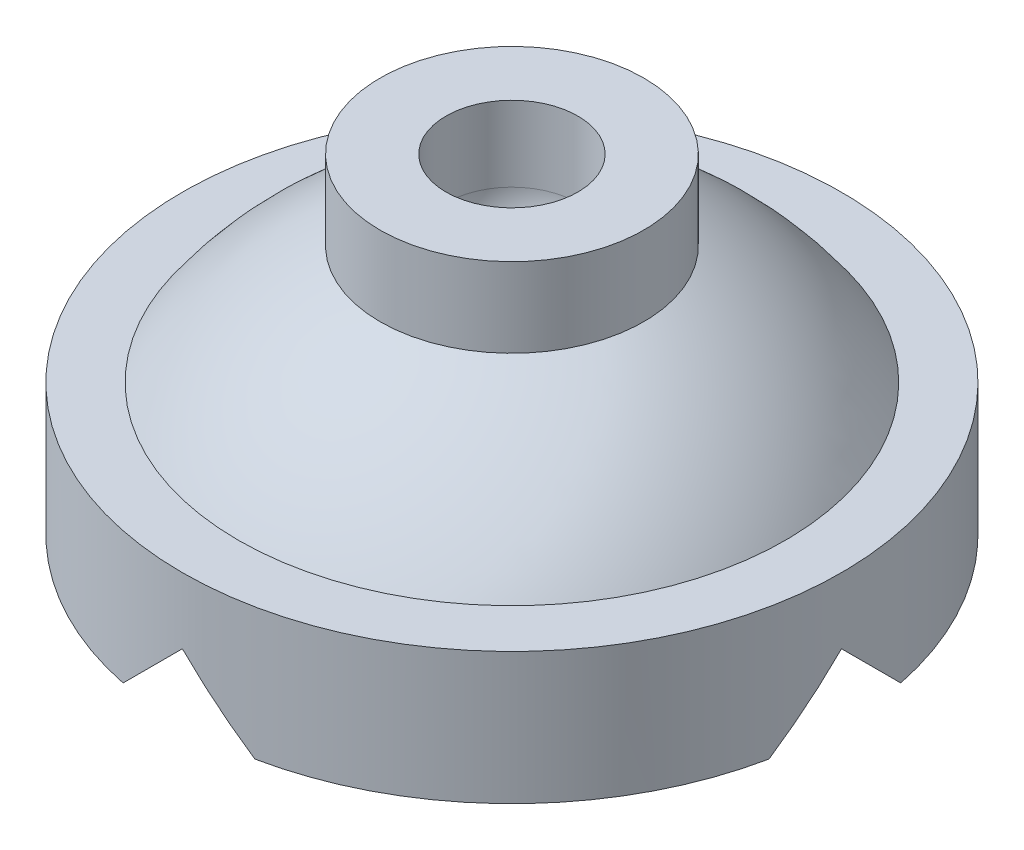
from build123d import *

# Parameters (mm, degrees)
CUT_EXTRUDE_1_DEPTH      = 30
CUT_EXTRUDE_2_DEPTH      = 44.301270189
CUT_EXTRUDE_2_DEPTH_BACK = 44.301270189


with BuildPart() as part:
    # Эскиз1 → Повернуть1 (revolve)
    with BuildSketch(Plane(origin=(0, 0, 0), x_dir=(0, 0, -1), z_dir=(1, 0, 0))):
        with BuildLine():
            Line((0, 0), (25, 0))
            Line((25, 0), (25, 10))
            Line((25, 10), (20.748340092, 10))
            ThreePointArc((20.748340092, 10), (15.979117923, 15.214609174), (10, 18.981275842))
            Line((10, 18.981275842), (10, 25))
            Line((10, 25), (5, 25))
            Line((5, 25), (5, 19.290902348))
            ThreePointArc((5, 19.290902348), (3.557868993, 15.701446772), (0, 14.183059008))
            Line((0, 14.183059008), (0, 0))
        make_face()
    revolve(axis=Axis((0, 30.068085096, 0), (0, -1, 0)))

    # Эскиз2 → Вырез-Вытянуть1 (cut, symmetric)
    with BuildSketch(Plane.XY):
        Polygon((-5, 0), (5, 0), (0, 5), align=None)
    extrude(amount=CUT_EXTRUDE_1_DEPTH, both=True, mode=Mode.SUBTRACT)

    # Эскиз3 → Вырез-Вытянуть2 (cut, two sides: drawn at the far end of the back side and taken through both)
    with BuildSketch(Plane(origin=(0, 0, 0), x_dir=(0, 0, -1), z_dir=(1, 0, 0)).offset(-CUT_EXTRUDE_2_DEPTH_BACK)):
        Polygon((-5, 0), (0, 5), (5, 0), align=None)
    extrude(amount=CUT_EXTRUDE_2_DEPTH + CUT_EXTRUDE_2_DEPTH_BACK, mode=Mode.SUBTRACT)


solid = part.part
